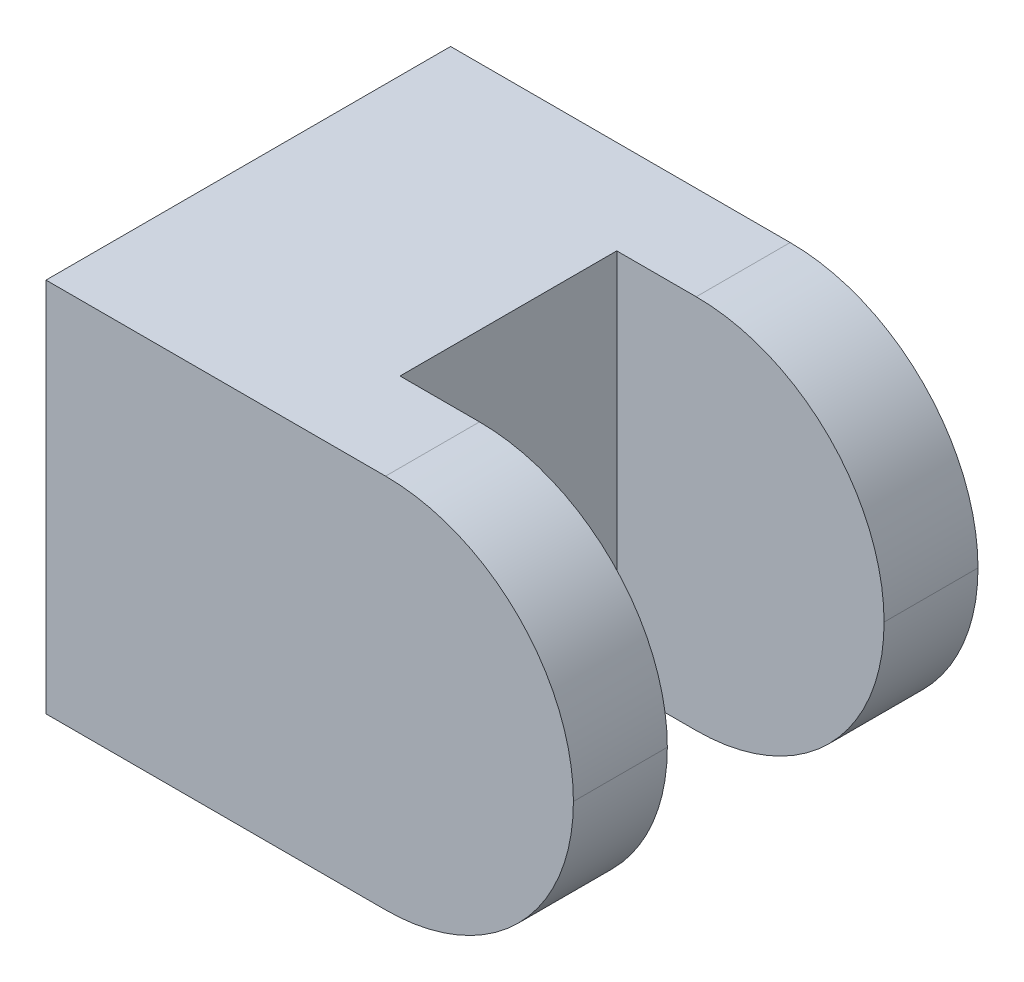
from build123d import *

# Parameters (mm, degrees)
IZIM1_W                     = 73
IZIM1_H                     = 52
Y_KSEKLIK_EKSTR_ZYON1_DEPTH = 56
IZIM2_W                     = 37
IZIM2_H                     = 30
KES_EKSTR_ZYON1_DEPTH       = 106.683489723
RADYUS1_R                   = 26
RADYUS2_R                   = 26
RADYUS3_R                   = 26
RADYUS5_R                   = 26


with BuildPart() as part:
    # Çizim1 → Yükseklik-Ekstrüzyon1 (new body)
    with BuildSketch(Plane.XY):
        with Locations((36.5, 26)):
            Rectangle(IZIM1_W, IZIM1_H)
    extrude(amount=Y_KSEKLIK_EKSTR_ZYON1_DEPTH)

    # Çizim2 → Kes-Ekstrüzyon1 (cut, through all)
    with BuildSketch(Plane(origin=(0, 52, 0), x_dir=(1, 0, 0), z_dir=(0, 1, 0))):
        with Locations((54.5, -28)):
            Rectangle(IZIM2_W, IZIM2_H)
    extrude(amount=-KES_EKSTR_ZYON1_DEPTH, mode=Mode.SUBTRACT)

    # Radyus1
    radyus1_edges = [part.edges().sort_by_distance(p)[0] for p in [
        (73, 52, 49.5),
    ]]
    fillet(radyus1_edges, radius=RADYUS1_R)

    # Radyus2
    radyus2_edges = [part.edges().sort_by_distance(p)[0] for p in [
        (73, 0, 49.5),
    ]]
    fillet(radyus2_edges, radius=RADYUS2_R - 0.0001)  # a hair under: the kernel refuses the full size

    # Radyus3
    radyus3_edges = [part.edges().sort_by_distance(p)[0] for p in [
        (73, 52, 6.5),
    ]]
    fillet(radyus3_edges, radius=RADYUS3_R)

    # Radyus5
    radyus5_edges = [part.edges().sort_by_distance(p)[0] for p in [
        (73, 0, 6.5),
    ]]
    fillet(radyus5_edges, radius=RADYUS5_R - 0.0001)  # a hair under: the kernel refuses the full size


solid = part.part
